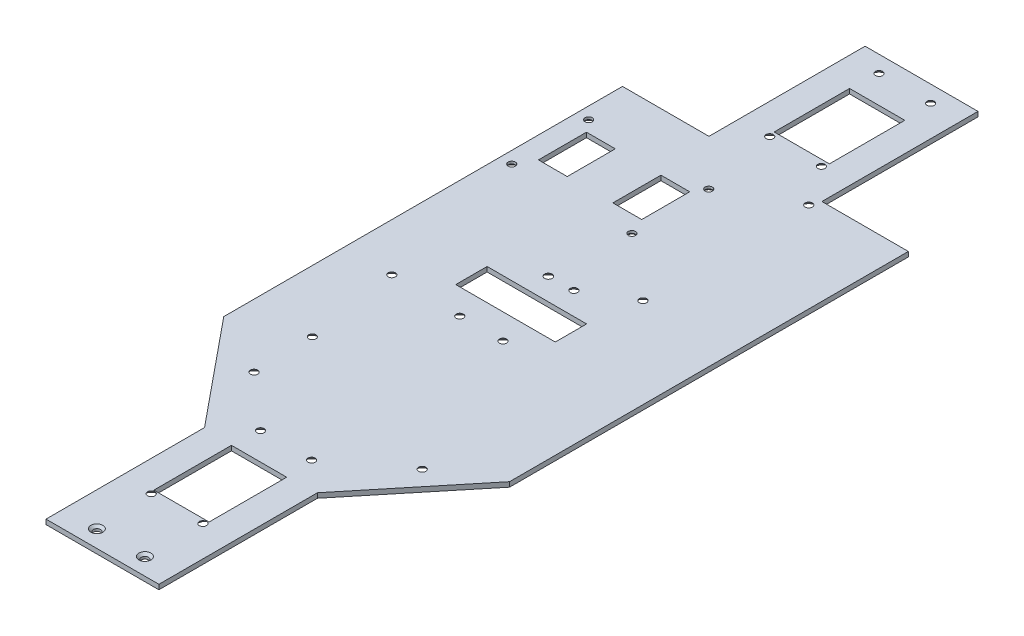
from build123d import *

# Parameters (mm, degrees)
BOSS_EXTRUDE2_DEPTH = 2
SKETCH5_W           = 23
SKETCH5_H           = 26
CUT_EXTRUDE1_DEPTH  = 2
SKETCH6_W           = 23
SKETCH6_H           = 26
CUT_EXTRUDE2_DEPTH  = 2
SKETCH7_W           = 12
SKETCH7_H           = 20
CUT_EXTRUDE3_DEPTH  = 2
SKETCH8_W           = 12
SKETCH8_H           = 20
CUT_EXTRUDE4_DEPTH  = 2
SKETCH9_R           = 1.5
CUT_EXTRUDE5_DEPTH  = 4
SKETCH10_R          = 1.5
CUT_EXTRUDE6_DEPTH  = 4
SKETCH11_R          = 1.5
SKETCH11_R_2        = 1.556495296
CUT_EXTRUDE7_DEPTH  = 4
CHAMFER1_SIZE       = 2
SKETCH12_W          = 41.427208619
SKETCH12_H          = 13.04809718
CUT_EXTRUDE8_DEPTH  = 4
SKETCH13_R          = 1.5
CUT_EXTRUDE9_DEPTH  = 10
CHAMFER2_SIZE       = 2
SKETCH14_W          = 23
SKETCH14_H          = 3.896287967
BOSS_EXTRUDE3_DEPTH = 2
SKETCH15_W          = 23
SKETCH15_H          = 6.016100964
CUT_EXTRUDE10_DEPTH = 2
SKETCH16_W          = 23
SKETCH16_H          = 4.189884345
CUT_EXTRUDE11_DEPTH = 2
SKETCH17_R          = 1.5
CUT_EXTRUDE12_DEPTH = 2
CHAMFER4_SIZE       = 2
SKETCH19_W          = 23
SKETCH19_H          = 7.922215634
CUT_EXTRUDE13_DEPTH = 2
SKETCH20_W          = 23
SKETCH20_H          = 2.611384529
CUT_EXTRUDE14_DEPTH = 2
SKETCH22_W          = 23
SKETCH22_H          = 5.13756828
BOSS_EXTRUDE5_DEPTH = 2
SKETCH23_R          = 1.5
CUT_EXTRUDE16_DEPTH = 2
CHAMFER6_SIZE       = 2
SKETCH24_R          = 1.5
CUT_EXTRUDE17_DEPTH = 10
CHAMFER7_SIZE       = 1
CUT_EXTRUDE18_REACH = 352.962
SKETCH25_R          = 1.5
CHAMFER8_SIZE       = 1


# Some blends are built 0.0001 mm under size
with BuildPart() as part:
    # Sketch4 → Boss-Extrude2 (new body)
    with BuildSketch(Plane(origin=(0, 0, 0), x_dir=(1, 0, 0), z_dir=(0, 1, 0))):
        Polygon((0, 341), (0, 276), (-36, 276), (-36, 110), (0, 66), (0, 0), (47, 0), (47, 66), (83, 110), (83, 276), (47, 276), (47, 341), align=None)
    extrude(amount=BOSS_EXTRUDE2_DEPTH)

    # Sketch5 → Cut-Extrude1 (cut)
    with BuildSketch(Plane(origin=(0, 2, 0), x_dir=(1, 0, 0), z_dir=(0, 1, 0))):
        with Locations((23.5, 42)):
            Rectangle(SKETCH5_W, SKETCH5_H)
    extrude(amount=-CUT_EXTRUDE1_DEPTH, mode=Mode.SUBTRACT)

    # Sketch6 → Cut-Extrude2 (cut)
    with BuildSketch(Plane(origin=(0, 2, 0), x_dir=(1, 0, 0), z_dir=(0, 1, 0))):
        with Locations((23.5, 299)):
            Rectangle(SKETCH6_W, SKETCH6_H)
    extrude(amount=-CUT_EXTRUDE2_DEPTH, mode=Mode.SUBTRACT)

    # Sketch7 → Cut-Extrude3 (cut)
    with BuildSketch(Plane(origin=(0, 2, 0), x_dir=(1, 0, 0), z_dir=(0, 1, 0))):
        with Locations((-21, 242)):
            Rectangle(SKETCH7_W, SKETCH7_H)
    extrude(amount=-CUT_EXTRUDE3_DEPTH, mode=Mode.SUBTRACT)

    # Sketch8 → Cut-Extrude4 (cut)
    with BuildSketch(Plane(origin=(0, 2, 0), x_dir=(1, 0, 0), z_dir=(0, 1, 0))):
        with Locations((10, 242)):
            Rectangle(SKETCH8_W, SKETCH8_H)
    extrude(amount=-CUT_EXTRUDE4_DEPTH, mode=Mode.SUBTRACT)

    # Sketch9 → Cut-Extrude5 (cut)
    with BuildSketch(Plane(origin=(0, 2, 0), x_dir=(1, 0, 0), z_dir=(0, 1, 0))):
        with Locations(Location((-9.668146344, 96.299430829, 0), (0, 0, 270))):
            Circle(SKETCH9_R)
        with Locations(Location((60.331853656, 96.299430845, 0), (0, 0, 270))):
            Circle(SKETCH9_R)
    extrude(amount=-CUT_EXTRUDE5_DEPTH, mode=Mode.SUBTRACT)

    # Sketch10 → Cut-Extrude6 (cut)
    with BuildSketch(Plane(origin=(0, 2, 0), x_dir=(1, 0, 0), z_dir=(0, 1, 0))):
        with Locations(Location((45.515605611, 272, 0), (0, 0, 270))):
            Circle(SKETCH10_R)
        with Locations(Location((45.515605611, 203, 0), (0, 0, 270))):
            Circle(SKETCH10_R)
    extrude(amount=-CUT_EXTRUDE6_DEPTH, mode=Mode.SUBTRACT)

    # Sketch11 → Cut-Extrude7 (cut)
    with BuildSketch(Plane(origin=(0, 2, 0), x_dir=(1, 0, 0), z_dir=(0, 1, 0))):
        with Locations(Location((27.453567096, 192.29943079, 0), (0, 0, 270))):
            Circle(SKETCH11_R)
        with Locations(Location((16.999402189, 192.117575161, 0), (0, 0, 270))):
            Circle(SKETCH11_R_2)
        with Locations(Location((12.953567087, 159.299430834, 0), (0, 0, 270))):
            Circle(SKETCH11_R)
        with Locations(Location((30.953567087, 159.299430838, 0), (0, 0, 270))):
            Circle(SKETCH11_R)
    extrude(amount=-CUT_EXTRUDE7_DEPTH, mode=Mode.SUBTRACT)

    # Chamfer1
    chamfer1_edges = [part.edges().sort_by_distance(p)[0] for p in [
        (-9.668146344, 0, -97.799430829),
        (60.331853656, 0, -97.799430845),
        (45.515605611, 0, -273.5),
        (45.515605611, 0, -204.5),
        (30.953567087, 0, -160.799430838),
        (12.953567087, 0, -160.799430834),
        (16.999402189, 0, -193.674070457),
        (27.453567096, 0, -193.79943079),
    ]]
    chamfer(chamfer1_edges, length=CHAMFER1_SIZE - 0.0001)  # a hair under: the kernel refuses the full size

    # Sketch12 → Cut-Extrude8 (cut)
    with BuildSketch(Plane(origin=(0, 2, 0), x_dir=(1, 0, 0), z_dir=(0, 1, 0))):
        with Locations((21.45416489, 176.373831134)):
            Rectangle(SKETCH12_W, SKETCH12_H)
    extrude(amount=-CUT_EXTRUDE8_DEPTH, mode=Mode.SUBTRACT)

    # Sketch13 → Cut-Extrude9 (cut)
    with BuildSketch(Plane(origin=(0, 2, 0), x_dir=(1, 0, 0), z_dir=(0, 1, 0))):
        with Locations(Location((-16.085510492, 160.04183924, 0), (0, 0, 270))):
            Circle(SKETCH13_R)
        with Locations(Location((-10.282531236, 121.164739857, 0), (0, 0, 270))):
            Circle(SKETCH13_R)
    extrude(amount=-CUT_EXTRUDE9_DEPTH, mode=Mode.SUBTRACT)

    # Chamfer2
    chamfer2_edges = [part.edges().sort_by_distance(p)[0] for p in [
        (-16.085510492, 0, -161.54183924),
        (-10.282531236, 0, -122.664739857),
    ]]
    chamfer(chamfer2_edges, length=CHAMFER2_SIZE - 0.0001)  # a hair under: the kernel refuses the full size

    # Sketch14 → Boss-Extrude3 (add)
    with BuildSketch(Plane(origin=(0, 0, 0), x_dir=(-1, 0, 0), z_dir=(0, -1, 0))):
        with Locations((-23.5, 30.948143984)):
            Rectangle(SKETCH14_W, SKETCH14_H)
    extrude(amount=-BOSS_EXTRUDE3_DEPTH)

    # Sketch15 → Cut-Extrude10 (cut)
    with BuildSketch(Plane.XZ):
        with Locations((23.5, -58.008050482)):
            Rectangle(SKETCH15_W, SKETCH15_H)
    extrude(amount=-CUT_EXTRUDE10_DEPTH, mode=Mode.SUBTRACT)

    # Sketch16 → Cut-Extrude11 (cut)
    with BuildSketch(Plane.XZ):
        with Locations((23.5, -63.111043137)):
            Rectangle(SKETCH16_W, SKETCH16_H)
    extrude(amount=-CUT_EXTRUDE11_DEPTH, mode=Mode.SUBTRACT)

    # Sketch17 → Cut-Extrude12 (cut)
    with BuildSketch(Plane(origin=(0, 2, 0), x_dir=(1, 0, 0), z_dir=(0, 1, 0))):
        with Locations(Location((34.01068775, 76.54942652, 0), (0, 0, 270))):
            Circle(SKETCH17_R)
        with Locations(Location((12.76068775, 76.549426515, 0), (0, 0, 270))):
            Circle(SKETCH17_R)
        with Locations(Location((12.760687761, 31.049426515, 0), (0, 0, 270))):
            Circle(SKETCH17_R)
        with Locations(Location((34.260687761, 31.04942652, 0), (0, 0, 270))):
            Circle(SKETCH17_R)
    extrude(amount=-CUT_EXTRUDE12_DEPTH, mode=Mode.SUBTRACT)

    # Chamfer4
    # the kernel refuses this chamfer: 2 mm, written as the material it takes off along each edge
    with BuildSketch(Plane(origin=(34.260687761, 0, -31.04942652), x_dir=(0, 0, 1), z_dir=(-1, 0, 0))) as chamfer4_piece_1:
        Polygon((1.5 + CHAMFER4_SIZE, 0), (1.5, CHAMFER4_SIZE), (1.5, 0), align=None)
    revolve(axis=Axis((34.260687761, 0, -31.04942652), (0, 1, 0)), mode=Mode.SUBTRACT)
    with BuildSketch(Plane(origin=(12.760687761, 0, -31.049426515), x_dir=(0, 0, 1), z_dir=(-1, 0, 0))) as chamfer4_piece_2:
        Polygon((1.5 + CHAMFER4_SIZE, 0), (1.5, CHAMFER4_SIZE), (1.5, 0), align=None)
    revolve(axis=Axis((12.760687761, 0, -31.049426515), (0, 1, 0)), mode=Mode.SUBTRACT)
    with BuildSketch(Plane(origin=(12.76068775, 0, -76.549426515), x_dir=(0, 0, 1), z_dir=(-1, 0, 0))) as chamfer4_piece_3:
        Polygon((1.5 + CHAMFER4_SIZE, 0), (1.5, CHAMFER4_SIZE), (1.5, 0), align=None)
    revolve(axis=Axis((12.76068775, 0, -76.549426515), (0, 1, 0)), mode=Mode.SUBTRACT)
    with BuildSketch(Plane(origin=(34.01068775, 0, -76.54942652), x_dir=(0, 0, 1), z_dir=(-1, 0, 0))) as chamfer4_piece_4:
        Polygon((1.5 + CHAMFER4_SIZE, 0), (1.5, CHAMFER4_SIZE), (1.5, 0), align=None)
    revolve(axis=Axis((34.01068775, 0, -76.54942652), (0, 1, 0)), mode=Mode.SUBTRACT)

    # Sketch19 → Cut-Extrude13 (cut)
    with BuildSketch(Plane.XZ):
        with Locations((23.5, -315.961107817)):
            Rectangle(SKETCH19_W, SKETCH19_H)
    extrude(amount=-CUT_EXTRUDE13_DEPTH, mode=Mode.SUBTRACT)

    # Sketch20 → Cut-Extrude14 (cut)
    with BuildSketch(Plane.XZ):
        with Locations((23.5, -321.227907899)):
            Rectangle(SKETCH20_W, SKETCH20_H)
    extrude(amount=-CUT_EXTRUDE14_DEPTH, mode=Mode.SUBTRACT)

    # Sketch22 → Boss-Extrude5 (add)
    with BuildSketch(Plane(origin=(0, 0, 0), x_dir=(-1, 0, 0), z_dir=(0, -1, 0))):
        with Locations((-23.5, 288.56878414)):
            Rectangle(SKETCH22_W, SKETCH22_H)
    extrude(amount=-BOSS_EXTRUDE5_DEPTH)

    # Sketch23 → Cut-Extrude16 (cut)
    with BuildSketch(Plane(origin=(0, 2, 0), x_dir=(1, 0, 0), z_dir=(0, 1, 0))):
        with Locations(Location((12.74123696, 334.049079093, 0), (0, 0, 270))):
            Circle(SKETCH23_R)
        with Locations(Location((34.24123696, 334.049079093, 0), (0, 0, 270))):
            Circle(SKETCH23_R)
        with Locations(Location((34.24123696, 288.549079093, 0), (0, 0, 270))):
            Circle(SKETCH23_R)
        with Locations(Location((12.74123696, 288.549079093, 0), (0, 0, 270))):
            Circle(SKETCH23_R)
    extrude(amount=-CUT_EXTRUDE16_DEPTH, mode=Mode.SUBTRACT)

    # Chamfer6
    # the kernel refuses this chamfer: 2 mm, written as the material it takes off along each edge
    with BuildSketch(Plane(origin=(12.74123696, 0, -288.549079093), x_dir=(0, 0, 1), z_dir=(-1, 0, 0))) as chamfer6_piece_1:
        Polygon((1.5 + CHAMFER6_SIZE, 0), (1.5, CHAMFER6_SIZE), (1.5, 0), align=None)
    revolve(axis=Axis((12.74123696, 0, -288.549079093), (0, 1, 0)), mode=Mode.SUBTRACT)
    with BuildSketch(Plane(origin=(34.24123696, 0, -288.549079093), x_dir=(0, 0, 1), z_dir=(-1, 0, 0))) as chamfer6_piece_2:
        Polygon((1.5 + CHAMFER6_SIZE, 0), (1.5, CHAMFER6_SIZE), (1.5, 0), align=None)
    revolve(axis=Axis((34.24123696, 0, -288.549079093), (0, 1, 0)), mode=Mode.SUBTRACT)
    with BuildSketch(Plane(origin=(34.24123696, 0, -334.049079093), x_dir=(0, 0, 1), z_dir=(-1, 0, 0))) as chamfer6_piece_3:
        Polygon((1.5 + CHAMFER6_SIZE, 0), (1.5, CHAMFER6_SIZE), (1.5, 0), align=None)
    revolve(axis=Axis((34.24123696, 0, -334.049079093), (0, 1, 0)), mode=Mode.SUBTRACT)
    with BuildSketch(Plane(origin=(12.74123696, 0, -334.049079093), x_dir=(0, 0, 1), z_dir=(-1, 0, 0))) as chamfer6_piece_4:
        Polygon((1.5 + CHAMFER6_SIZE, 0), (1.5, CHAMFER6_SIZE), (1.5, 0), align=None)
    revolve(axis=Axis((12.74123696, 0, -334.049079093), (0, 1, 0)), mode=Mode.SUBTRACT)

    # Sketch24 → Cut-Extrude17 (cut)
    with BuildSketch(Plane(origin=(0, 2, 0), x_dir=(1, 0, 0), z_dir=(0, 1, 0))):
        with Locations(Location((-31.031546179, 256.928363681, 0), (0, 0, 270))):
            Circle(SKETCH24_R)
        with Locations(Location((-31.031546172, 224.928363681, 0), (0, 0, 270))):
            Circle(SKETCH24_R)
        with Locations(Location((18.968453821, 256.928363693, 0), (0, 0, 270))):
            Circle(SKETCH24_R)
        with Locations(Location((18.968453828, 224.928363693, 0), (0, 0, 270))):
            Circle(SKETCH24_R)
    extrude(amount=-CUT_EXTRUDE17_DEPTH, mode=Mode.SUBTRACT)

    # Chamfer7
    chamfer7_edges = [part.edges().sort_by_distance(p)[0] for p in [
        (-31.031546172, 0, -226.428363681),
        (18.968453821, 0, -258.428363693),
        (18.968453828, 0, -226.428363693),
        (-31.031546179, 0, -258.428363681),
    ]]
    chamfer(chamfer7_edges, length=CHAMFER7_SIZE)

    # Sketch25 → Cut-Extrude18 (cut, up to next)
    with BuildSketch(Plane.XZ, mode=Mode.PRIVATE) as cut_extrude18_sk1:
        with Locations(Location((14.087342161, -7.092513938, 0), (0, 0, 270))):
            Circle(SKETCH25_R)
    cut_extrude18_tool1 = extrude(cut_extrude18_sk1.sketch, amount=-CUT_EXTRUDE18_REACH, mode=Mode.PRIVATE) & part.part
    # Sketch25 → Cut-Extrude18 (cut, up to next)
    with BuildSketch(Plane.XZ, mode=Mode.PRIVATE) as cut_extrude18_sk2:
        with Locations(Location((34.087342161, -7.092513938, 0), (0, 0, 270))):
            Circle(SKETCH25_R)
    cut_extrude18_tool2 = extrude(cut_extrude18_sk2.sketch, amount=-CUT_EXTRUDE18_REACH, mode=Mode.PRIVATE) & part.part
    add(cut_extrude18_tool1.solids().sort_by_distance((14.087342, 0, -7.092514))[0], mode=Mode.SUBTRACT)
    add(cut_extrude18_tool2.solids().sort_by_distance((34.087342, 0, -7.092514))[0], mode=Mode.SUBTRACT)

    # Chamfer8
    chamfer8_edges = [part.edges().sort_by_distance(p)[0] for p in [
        (14.087342161, 2, -5.592513938),
        (34.087342161, 2, -5.592513938),
    ]]
    chamfer(chamfer8_edges, length=CHAMFER8_SIZE)


solid = part.part
